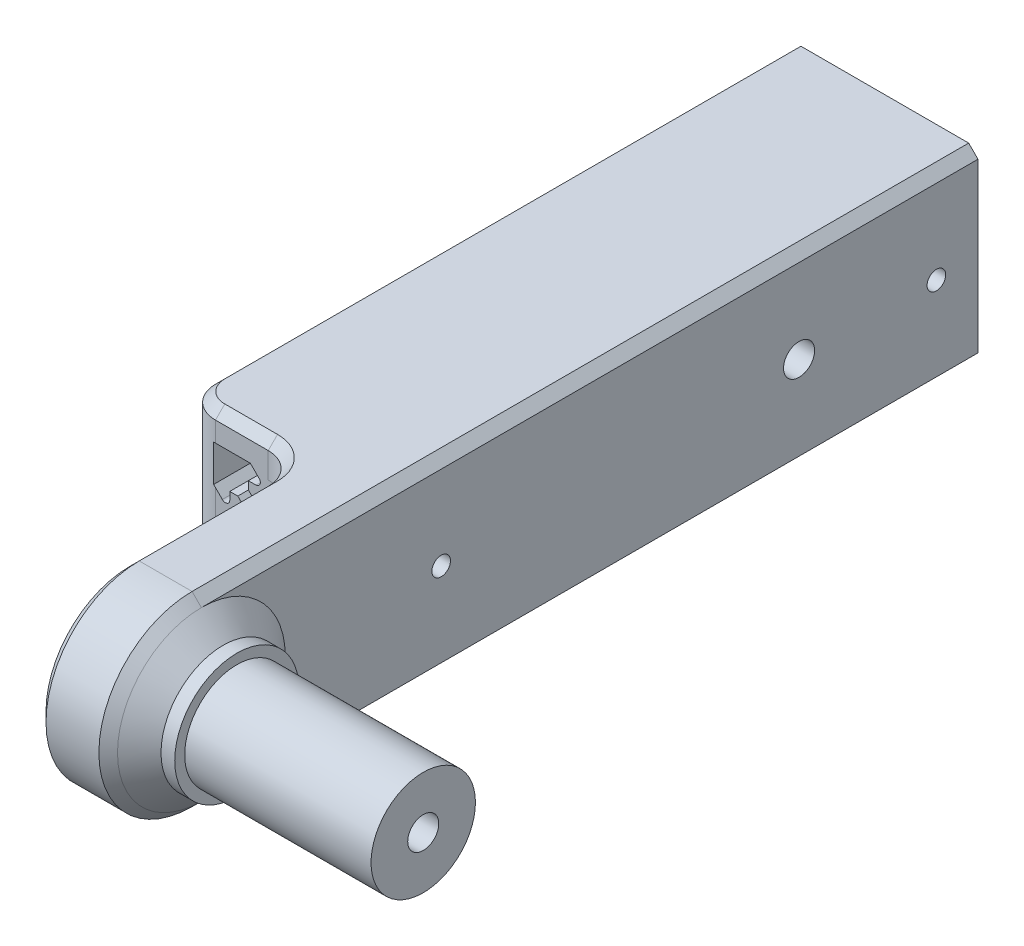
from build123d import *

# Parameters (mm, degrees)
SKETCH1_W               = 30
SKETCH1_H               = 30
BOSS_EXTRUDE3_DEPTH     = 95
BOSS_EXTRUDE4_DEPTH     = 30
CUT_EXTRUDE1_DEPTH      = 147.287388383
SKETCH5_R               = 10
BOSS_EXTRUDE5_DEPTH     = 5.71
SKETCH6_R               = 8.4
BOSS_EXTRUDE6_DEPTH     = 30
SKETCH8_R               = 1.5
SKETCH8_R_2             = 2.5
CUT_EXTRUDE2_DEPTH      = 158.536675412
CHAMFER1_SIZE           = 1.5
CHAMFER2_SIZE           = 3.5
CUT_EXTRUDE3_DEPTH      = 17
CUT_EXTRUDE4_DEPTH      = 10
CUT_EXTRUDE4_DEPTH_BACK = 2
SKETCH10_W              = 14.270411079
SKETCH10_H              = 4.897722898


with BuildPart() as part:
    # Sketch1 → Boss-Extrude3 (new body)
    with BuildSketch(Plane.XY):
        with Locations((15, 15)):
            Rectangle(SKETCH1_W, SKETCH1_H)
        with BuildLine():
            Line((17.802943725, 19.5), (12.197056275, 19.5))
            Line((12.197056275, 19.5), (10.289949494, 21.407106781))
            Line((10.289949494, 21.407106781), (10.289949494, 22.7))
            Line((10.289949494, 22.7), (11.517157288, 22.7))
            ThreePointArc((11.517157288, 22.7), (12.16387296, 23.132121597), (12.012132034, 23.894974747))
            Line((12.012132034, 23.894974747), (10.612132034, 25.294974747))
            Line((10.612132034, 25.294974747), (4.705025253, 25.294974747))
            Line((4.705025253, 25.294974747), (4.705025253, 19.387867966))
            Line((4.705025253, 19.387867966), (6.105025253, 17.987867966))
            ThreePointArc((6.105025253, 17.987867966), (6.867878403, 17.83612704), (7.3, 18.482842712))
            Line((7.3, 18.482842712), (7.3, 19.710050506))
            Line((7.3, 19.710050506), (8.592893219, 19.710050506))
            Line((8.592893219, 19.710050506), (10.5, 17.802943725))
            Line((10.5, 17.802943725), (10.5, 12.197056275))
            Line((10.5, 12.197056275), (8.592893219, 10.289949494))
            Line((8.592893219, 10.289949494), (7.3, 10.289949494))
            Line((7.3, 10.289949494), (7.3, 11.517157288))
            ThreePointArc((7.3, 11.517157288), (6.867878403, 12.16387296), (6.105025253, 12.012132034))
            Line((6.105025253, 12.012132034), (4.705025253, 10.612132034))
            Line((4.705025253, 10.612132034), (4.705025253, 4.705025253))
            Line((4.705025253, 4.705025253), (10.612132034, 4.705025253))
            Line((10.612132034, 4.705025253), (12.012132034, 6.105025253))
            ThreePointArc((12.012132034, 6.105025253), (12.16387296, 6.867878403), (11.517157288, 7.3))
            Line((11.517157288, 7.3), (10.289949494, 7.3))
            Line((10.289949494, 7.3), (10.289949494, 8.592893219))
            Line((10.289949494, 8.592893219), (12.197056275, 10.5))
            Line((12.197056275, 10.5), (17.802943725, 10.5))
            Line((17.802943725, 10.5), (19.710050506, 8.592893219))
            Line((19.710050506, 8.592893219), (19.710050506, 7.3))
            Line((19.710050506, 7.3), (18.482842712, 7.3))
            ThreePointArc((18.482842712, 7.3), (17.83612704, 6.867878403), (17.987867966, 6.105025253))
            Line((17.987867966, 6.105025253), (19.387867966, 4.705025253))
            Line((19.387867966, 4.705025253), (25.294974747, 4.705025253))
            Line((25.294974747, 4.705025253), (25.294974747, 10.612132034))
            Line((25.294974747, 10.612132034), (23.894974747, 12.012132034))
            ThreePointArc((23.894974747, 12.012132034), (23.132121597, 12.16387296), (22.7, 11.517157288))
            Line((22.7, 11.517157288), (22.7, 10.289949494))
            Line((22.7, 10.289949494), (21.407106781, 10.289949494))
            Line((21.407106781, 10.289949494), (19.5, 12.197056275))
            Line((19.5, 12.197056275), (19.5, 17.802943725))
            Line((19.5, 17.802943725), (21.407106781, 19.710050506))
            Line((21.407106781, 19.710050506), (22.7, 19.710050506))
            Line((22.7, 19.710050506), (22.7, 18.482842712))
            ThreePointArc((22.7, 18.482842712), (23.132121597, 17.83612704), (23.894974747, 17.987867966))
            Line((23.894974747, 17.987867966), (25.294974747, 19.387867966))
            Line((25.294974747, 19.387867966), (25.294974747, 25.294974747))
            Line((25.294974747, 25.294974747), (19.387867966, 25.294974747))
            Line((19.387867966, 25.294974747), (17.987867966, 23.894974747))
            ThreePointArc((17.987867966, 23.894974747), (17.83612704, 23.132121597), (18.482842712, 22.7))
            Line((18.482842712, 22.7), (19.710050506, 22.7))
            Line((19.710050506, 22.7), (19.710050506, 21.407106781))
            Line((19.710050506, 21.407106781), (17.802943725, 19.5))
        make_face(mode=Mode.SUBTRACT)
    extrude(amount=BOSS_EXTRUDE3_DEPTH)

    # Sketch3 → Boss-Extrude4 (add)
    with BuildSketch(Plane(origin=(30, 0, 0), x_dir=(0, 0, -1), z_dir=(1, 0, 0))):
        with BuildLine():
            Line((-125, 30), (-95, 30))
            Line((-95, 30), (-95, 0))
            Line((-95, 0), (-125, 0))
            ThreePointArc((-125, 0), (-140, 15), (-125, 30))
        make_face()
    extrude(amount=-BOSS_EXTRUDE4_DEPTH)

    # Sketch4 → Cut-Extrude1 (cut, through all)
    with BuildSketch(Plane(origin=(0, 30, 0), x_dir=(1, 0, 0), z_dir=(0, 1, 0))):
        with BuildLine():
            Line((5, -97.729588921), (13.490616116, -97.729588921))
            ThreePointArc((13.490616116, -97.729588921), (17.026150022, -99.194055015), (18.490616116, -102.729588921))
            Line((18.490616116, -102.729588921), (18.490616116, -140))
            Line((18.490616116, -140), (0, -140))
            Line((0, -140), (0, -92.729588921))
            ThreePointArc((0, -92.729588921), (1.464466094, -96.265122827), (5, -97.729588921))
        make_face()
    extrude(amount=-CUT_EXTRUDE1_DEPTH, mode=Mode.SUBTRACT)

    # Sketch5 → Boss-Extrude5 (add)
    with BuildSketch(Plane(origin=(30, 0, 0), x_dir=(0, 0, -1), z_dir=(1, 0, 0))):
        with Locations(Location((-125, 15, 0), (0, 0, 180))):
            Circle(SKETCH5_R)
    extrude(amount=BOSS_EXTRUDE5_DEPTH)

    # Sketch6 → Boss-Extrude6 (add)
    with BuildSketch(Plane(origin=(35.71, 0, 0), x_dir=(0, 0, -1), z_dir=(1, 0, 0))):
        with Locations((-125, 15)):
            Circle(SKETCH6_R)
    extrude(amount=BOSS_EXTRUDE6_DEPTH)

    # Sketch8 → Cut-Extrude2 (cut, through all)
    with BuildSketch(Plane.ZY):
        with Locations((6.7, 15)):
            Circle(SKETCH8_R)
        with Locations((86.4, 15)):
            Circle(SKETCH8_R)
        with Locations((28.8, 15)):
            Circle(SKETCH8_R_2)
        with Locations((125, 15)):
            Circle(SKETCH8_R_2)
    extrude(amount=-CUT_EXTRUDE2_DEPTH, mode=Mode.SUBTRACT)

    # Chamfer1
    chamfer1_edges = [part.edges().sort_by_distance(p)[0] for p in [
        (30, 15, 140),
        (18.490616116, 15, 140),
        (0, 30, 46.364794461),
        (0, 0, 46.364794461),
        (18.490616116, 30, 113.864794461),
        (17.026150022, 30, 99.194055015),
        (9.245308058, 30, 97.729588921),
        (1.464466094, 30, 96.265122827),
        (18.490616116, 0, 113.864794461),
        (1.464466094, 0, 96.265122827),
        (9.245308058, 0, 97.729588921),
        (17.026150022, 0, 99.194055015),
        (30, 30, 62.5),
        (30, 0, 62.5),
    ]]
    chamfer(chamfer1_edges, length=CHAMFER1_SIZE)

    # Chamfer2
    chamfer2_edges = [part.edges().sort_by_distance(p)[0] for p in [
        (30, 15, 115),
    ]]
    chamfer(chamfer2_edges, length=CHAMFER2_SIZE - 0.0001)  # a hair under: the kernel refuses the full size

    # Sketch9 → Cut-Extrude3 (cut)
    with BuildSketch(Plane(origin=(0, 0, 95), x_dir=(-1, 0, 0), z_dir=(0, 0, -1))):
        with BuildLine():
            Line((-10.612132034, 4.705025253), (-4.705025253, 4.705025253))
            Line((-4.705025253, 4.705025253), (-4.705025253, 10.612132034))
            Line((-4.705025253, 10.612132034), (-6.105025253, 12.012132034))
            ThreePointArc((-6.105025253, 12.012132034), (-6.867878403, 12.16387296), (-7.3, 11.517157288))
            Line((-7.3, 11.517157288), (-7.3, 10.289949494))
            Line((-7.3, 10.289949494), (-8.592893219, 10.289949494))
            Line((-8.592893219, 10.289949494), (-10.5, 12.197056275))
            Line((-10.5, 12.197056275), (-10.5, 17.802943725))
            Line((-10.5, 17.802943725), (-8.592893219, 19.710050506))
            Line((-8.592893219, 19.710050506), (-7.3, 19.710050506))
            Line((-7.3, 19.710050506), (-7.3, 18.482842712))
            ThreePointArc((-7.3, 18.482842712), (-6.867878403, 17.83612704), (-6.105025253, 17.987867966))
            Line((-6.105025253, 17.987867966), (-4.705025253, 19.387867966))
            Line((-4.705025253, 19.387867966), (-4.705025253, 25.294974747))
            Line((-4.705025253, 25.294974747), (-10.612132034, 25.294974747))
            Line((-10.612132034, 25.294974747), (-12.012132034, 23.894974747))
            ThreePointArc((-12.012132034, 23.894974747), (-12.16387296, 23.132121597), (-11.517157288, 22.7))
            Line((-11.517157288, 22.7), (-10.289949494, 22.7))
            Line((-10.289949494, 22.7), (-10.289949494, 21.407106781))
            Line((-10.289949494, 21.407106781), (-12.197056275, 19.5))
            Line((-12.197056275, 19.5), (-17.802943725, 19.5))
            Line((-17.802943725, 19.5), (-19.710050506, 21.407106781))
            Line((-19.710050506, 21.407106781), (-19.710050506, 22.7))
            Line((-19.710050506, 22.7), (-18.482842712, 22.7))
            ThreePointArc((-18.482842712, 22.7), (-17.83612704, 23.132121597), (-17.987867966, 23.894974747))
            Line((-17.987867966, 23.894974747), (-19.387867966, 25.294974747))
            Line((-19.387867966, 25.294974747), (-25.294974747, 25.294974747))
            Line((-25.294974747, 25.294974747), (-25.294974747, 19.387867966))
            Line((-25.294974747, 19.387867966), (-23.894974747, 17.987867966))
            ThreePointArc((-23.894974747, 17.987867966), (-23.132121597, 17.83612704), (-22.7, 18.482842712))
            Line((-22.7, 18.482842712), (-22.7, 19.710050506))
            Line((-22.7, 19.710050506), (-21.407106781, 19.710050506))
            Line((-21.407106781, 19.710050506), (-19.5, 17.802943725))
            Line((-19.5, 17.802943725), (-19.5, 12.197056275))
            Line((-19.5, 12.197056275), (-21.407106781, 10.289949494))
            Line((-21.407106781, 10.289949494), (-22.7, 10.289949494))
            Line((-22.7, 10.289949494), (-22.7, 11.517157288))
            ThreePointArc((-22.7, 11.517157288), (-23.132121597, 12.16387296), (-23.894974747, 12.012132034))
            Line((-23.894974747, 12.012132034), (-25.294974747, 10.612132034))
            Line((-25.294974747, 10.612132034), (-25.294974747, 4.705025253))
            Line((-25.294974747, 4.705025253), (-19.387867966, 4.705025253))
            Line((-19.387867966, 4.705025253), (-17.987867966, 6.105025253))
            ThreePointArc((-17.987867966, 6.105025253), (-17.83612704, 6.867878403), (-18.482842712, 7.3))
            Line((-18.482842712, 7.3), (-19.710050506, 7.3))
            Line((-19.710050506, 7.3), (-19.710050506, 8.592893219))
            Line((-19.710050506, 8.592893219), (-17.802943725, 10.5))
            Line((-17.802943725, 10.5), (-12.197056275, 10.5))
            Line((-12.197056275, 10.5), (-10.289949494, 8.592893219))
            Line((-10.289949494, 8.592893219), (-10.289949494, 7.3))
            Line((-10.289949494, 7.3), (-11.517157288, 7.3))
            ThreePointArc((-11.517157288, 7.3), (-12.16387296, 6.867878403), (-12.012132034, 6.105025253))
            Line((-12.012132034, 6.105025253), (-10.612132034, 4.705025253))
        make_face()
    extrude(amount=-CUT_EXTRUDE3_DEPTH, mode=Mode.SUBTRACT)

    # Sketch10 → Cut-Extrude4 (cut, two sides: drawn at the far end of the back side and taken through both)
    with BuildSketch(Plane.ZY.offset(-18.490616116).offset(-CUT_EXTRUDE4_DEPTH_BACK)):
        with Locations((104.864794461, 21.948861449)):
            Rectangle(SKETCH10_W, SKETCH10_H)
        with Locations((104.864794461, 8.051138551)):
            Rectangle(SKETCH10_W, SKETCH10_H)
    extrude(amount=CUT_EXTRUDE4_DEPTH + CUT_EXTRUDE4_DEPTH_BACK, mode=Mode.SUBTRACT)


solid = part.part
